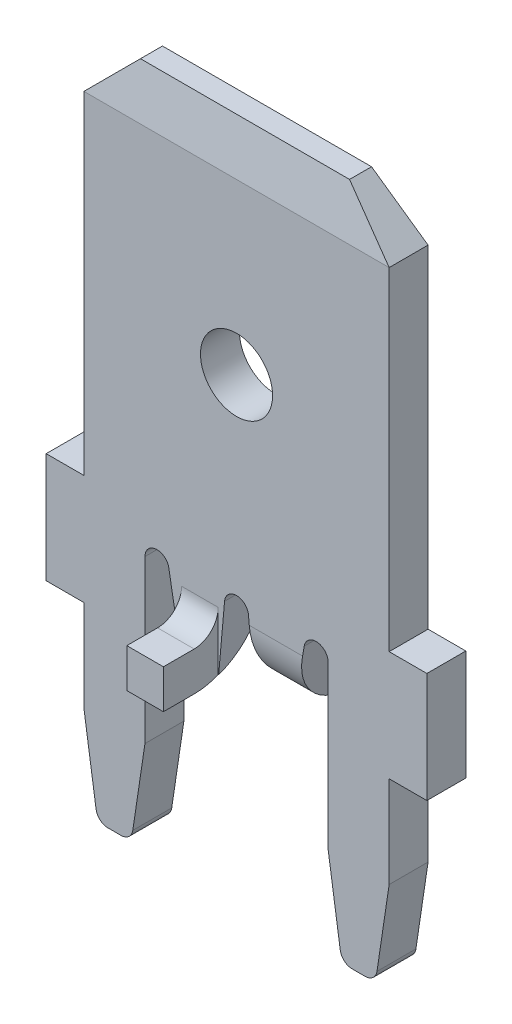
from build123d import *

# Parameters (mm, degrees)
SKETCH1_R      = 0.75
EXTRUDE1_DEPTH = 0.81
CHAMFER4_SIZE  = 1
CHAMFER4_SIZE2 = 0.176326981
CHAMFER5_SIZE  = 1
CHAMFER5_SIZE2 = 0.176326981
CHAMFER1_SIZE  = 1
SKETCH2_W      = 0.762
SKETCH2_H      = 0.81
EXTRUDE2_DEPTH = 1.14
SKETCH3_W      = 0.762
SKETCH3_H      = 0.81
EXTRUDE3_DEPTH = 1.14
FILLET1_R      = 0.5
FILLET2_R      = 1.31


with BuildPart() as part:
    # Sketch1 → Extrude1 (new body)
    with BuildSketch(Plane.XY):
        with BuildLine():
            Line((-3.175, 4.52), (3.175, 4.52))
            Line((3.175, 4.52), (3.175, -3.4))
            Line((3.175, -3.4), (3.96, -3.4))
            Line((3.96, -3.4), (3.96, -5.69))
            Line((3.96, -5.69), (3.175, -5.69))
            Line((3.175, -5.69), (3.175, -7.595))
            Line((3.175, -7.595), (2.921867651, -9.286989911))
            ThreePointArc((2.921867651, -9.286989911), (2.837794855, -9.43940364), (2.674619301, -9.5))
            Line((2.674619301, -9.5), (2.405380699, -9.5))
            ThreePointArc((2.405380699, -9.5), (2.242205145, -9.43940364), (2.158132349, -9.286989911))
            Line((2.158132349, -9.286989911), (1.905, -7.595))
            Line((1.905, -7.595), (1.905, -4.225996329))
            ThreePointArc((1.905, -4.225996329), (1.676788936, -3.976947655), (1.408798062, -4.182584285))
            Line((1.408798062, -4.182584285), (1.143, -5.69))
            Line((1.143, -5.69), (0.381, -5.69))
            Line((0.381, -5.69), (0.249019923, -4.203881227))
            ThreePointArc((0.249019923, -4.203881227), (0, -3.975996329), (-0.249019923, -4.203881227))
            Line((-0.249019923, -4.203881227), (-0.381, -5.69))
            Line((-0.381, -5.69), (-1.143, -5.69))
            Line((-1.143, -5.69), (-1.408798062, -4.182584285))
            ThreePointArc((-1.408798062, -4.182584285), (-1.676788936, -3.976947655), (-1.905, -4.225996329))
            Line((-1.905, -4.225996329), (-1.905, -7.595))
            Line((-1.905, -7.595), (-2.158132349, -9.286989911))
            ThreePointArc((-2.158132349, -9.286989911), (-2.242205145, -9.43940364), (-2.405380699, -9.5))
            Line((-2.405380699, -9.5), (-2.674619301, -9.5))
            ThreePointArc((-2.674619301, -9.5), (-2.837794855, -9.43940364), (-2.921867651, -9.286989911))
            Line((-2.921867651, -9.286989911), (-3.175, -7.595))
            Line((-3.175, -7.595), (-3.175, -5.69))
            Line((-3.175, -5.69), (-3.96, -5.69))
            Line((-3.96, -5.69), (-3.96, -3.4))
            Line((-3.96, -3.4), (-3.175, -3.4))
            Line((-3.175, -3.4), (-3.175, 4.52))
        make_face()
        Circle(SKETCH1_R, mode=Mode.SUBTRACT)
    extrude(amount=EXTRUDE1_DEPTH)

    # Chamfer4
    chamfer4_edges = [part.edges().sort_by_distance(p)[0] for p in [
        (0, 4.52, 0.81),
    ]]
    chamfer4_side = [part.faces().sort_by_distance(p)[0] for p in [
        (0, -1.422995991, 0.81),
    ]]
    chamfer(chamfer4_edges, length=CHAMFER4_SIZE, length2=CHAMFER4_SIZE2, reference=chamfer4_side[0])

    # Chamfer5
    chamfer5_edges = [part.edges().sort_by_distance(p)[0] for p in [
        (0, 4.52, 0),
    ]]
    chamfer5_side = [part.faces().sort_by_distance(p)[0] for p in [
        (0, -1.422995991, 0),
    ]]
    chamfer(chamfer5_edges, length=CHAMFER5_SIZE, length2=CHAMFER5_SIZE2, reference=chamfer5_side[0])

    # Chamfer1
    chamfer1_edges = [part.edges().sort_by_distance(p)[0] for p in [
        (-3.175, 4.52, 0.405),
        (3.175, 4.52, 0.405),
    ]]
    chamfer(chamfer1_edges, length=CHAMFER1_SIZE)

    # Sketch2 → Extrude2 (add)
    with BuildSketch(Plane.XY.offset(0.81)):
        with Locations((-0.762, -5.285)):
            Rectangle(SKETCH2_W, SKETCH2_H)
    extrude(amount=EXTRUDE2_DEPTH)

    # Sketch3 → Extrude3 (add)
    with BuildSketch(Plane(origin=(0, 0, 0), x_dir=(-1, 0, 0), z_dir=(0, 0, -1))):
        with Locations((-0.762, -5.285)):
            Rectangle(SKETCH3_W, SKETCH3_H)
    extrude(amount=EXTRUDE3_DEPTH)

    # Fillet1
    fillet1_edges = [part.edges().sort_by_distance(p)[0] for p in [
        (-0.762, -4.88, 0.81),
        (0.762, -4.88, 0),
    ]]
    fillet(fillet1_edges, radius=FILLET1_R)

    # Fillet2
    # the kernel refuses this fillet: 1.31 mm, written as the material it takes off along each edge
    with BuildSketch(Plane(origin=(2.894, -5.69, 0), x_dir=(0, 1, 0), z_dir=(-1, 0, 0))) as fillet2_piece_1_section:
        with BuildLine():
            CenterArc((FILLET2_R, -FILLET2_R), FILLET2_R, 90, 90)
            Line((0, -FILLET2_R), (0, 0))
            Line((0, 0), (FILLET2_R, 0))
        make_face()
    fillet2_piece_1 = extrude(amount=7.312, mode=Mode.PRIVATE)
    fillet2_piece_1 = split(fillet2_piece_1, bisect_by=Plane(origin=(-1.183630383, -5.45957365, 0.262964563), z_dir=(0.984807753012208, 0.17364817766693083, 0)), keep=Keep.TOP, mode=Mode.PRIVATE)
    fillet2_piece_1 = split(fillet2_piece_1, bisect_by=Plane(origin=(0.345201257, -5.286899882, 0.262964563), z_dir=(-0.9960796936325239, -0.08846040884450787, 0)), keep=Keep.TOP, mode=Mode.PRIVATE)
    add(fillet2_piece_1, mode=Mode.SUBTRACT)
    with BuildSketch(Plane(origin=(4.418, -5.69, 0.81), x_dir=(0, 1, 0), z_dir=(-1, 0, 0))) as fillet2_piece_2_section:
        with BuildLine():
            CenterArc((FILLET2_R, FILLET2_R), FILLET2_R, 180, 90)
            Line((0, FILLET2_R), (0, 0))
            Line((0, 0), (FILLET2_R, 0))
        make_face()
    fillet2_piece_2 = extrude(amount=7.312, mode=Mode.PRIVATE)
    fillet2_piece_2 = split(fillet2_piece_2, bisect_by=Plane(origin=(1.905, -5.189166234, 0.641921168), z_dir=(-1, 0, 0)), keep=Keep.TOP, mode=Mode.PRIVATE)
    fillet2_piece_2 = split(fillet2_piece_2, bisect_by=Plane(origin=(0.343178087, -5.264118635, 0.641921168), z_dir=(0.9960796936325239, 0.08846040884450787, 0)), keep=Keep.TOP, mode=Mode.PRIVATE)
    add(fillet2_piece_2, mode=Mode.SUBTRACT)


solid = part.part
